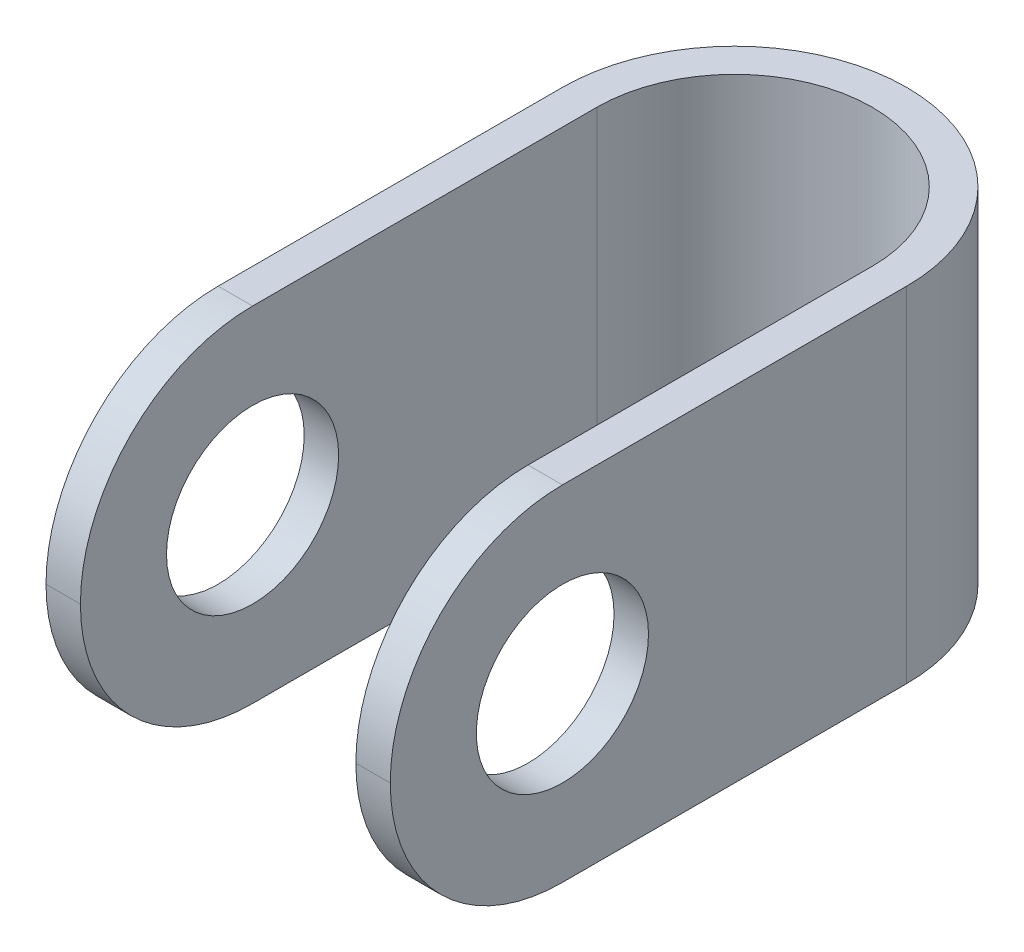
from build123d import *

# Parameters (mm, degrees)
BOSS_EXTRUDE1_DEPTH = 8
FILLET1_R           = 4
FILLET2_R           = 4
FILLET3_R           = 4
SKETCH2_R           = 2
CUT_EXTRUDE1_DEPTH  = 20.595917942


with BuildPart() as part:
    # Sketch1 → Boss-Extrude1 (new body)
    with BuildSketch(Plane(origin=(0, 0, 0), x_dir=(1, 0, 0), z_dir=(0, 1, 0))):
        with BuildLine():
            Line((0, 0), (0, 12))
            ThreePointArc((0, 12), (-3.2, 15.2), (-6.4, 12))
            Line((-6.4, 12), (-6.4, 0))
            Line((-6.4, 0), (-7.2, 0))
            Line((-7.2, 0), (-7.2, 12))
            ThreePointArc((-7.2, 12), (-3.2, 16), (0.8, 12))
            Line((0.8, 12), (0.8, 0))
            Line((0.8, 0), (0, 0))
        make_face()
    extrude(amount=BOSS_EXTRUDE1_DEPTH)

    # Fillet1
    fillet1_edges = [part.edges().sort_by_distance(p)[0] for p in [
        (0.4, 8, 0),
    ]]
    fillet(fillet1_edges, radius=FILLET1_R)

    # Fillet2
    fillet2_edges = [part.edges().sort_by_distance(p)[0] for p in [
        (0.4, 0, 0),
    ]]
    fillet(fillet2_edges, radius=FILLET2_R - 0.0001)  # a hair under: the kernel refuses the full size

    # Fillet3
    fillet3_edges = [part.edges().sort_by_distance(p)[0] for p in [
        (-6.8, 0, 0),
        (-6.8, 8, 0),
    ]]
    fillet(fillet3_edges, radius=FILLET3_R - 0.0001)  # a hair under: the kernel refuses the full size

    # Sketch2 → Cut-Extrude1 (cut, through all)
    with BuildSketch(Plane(origin=(0.8, 0, 0), x_dir=(0, 0, -1), z_dir=(1, 0, 0))):
        with Locations((4, 4)):
            Circle(SKETCH2_R)
    extrude(amount=-CUT_EXTRUDE1_DEPTH, mode=Mode.SUBTRACT)


solid = part.part
